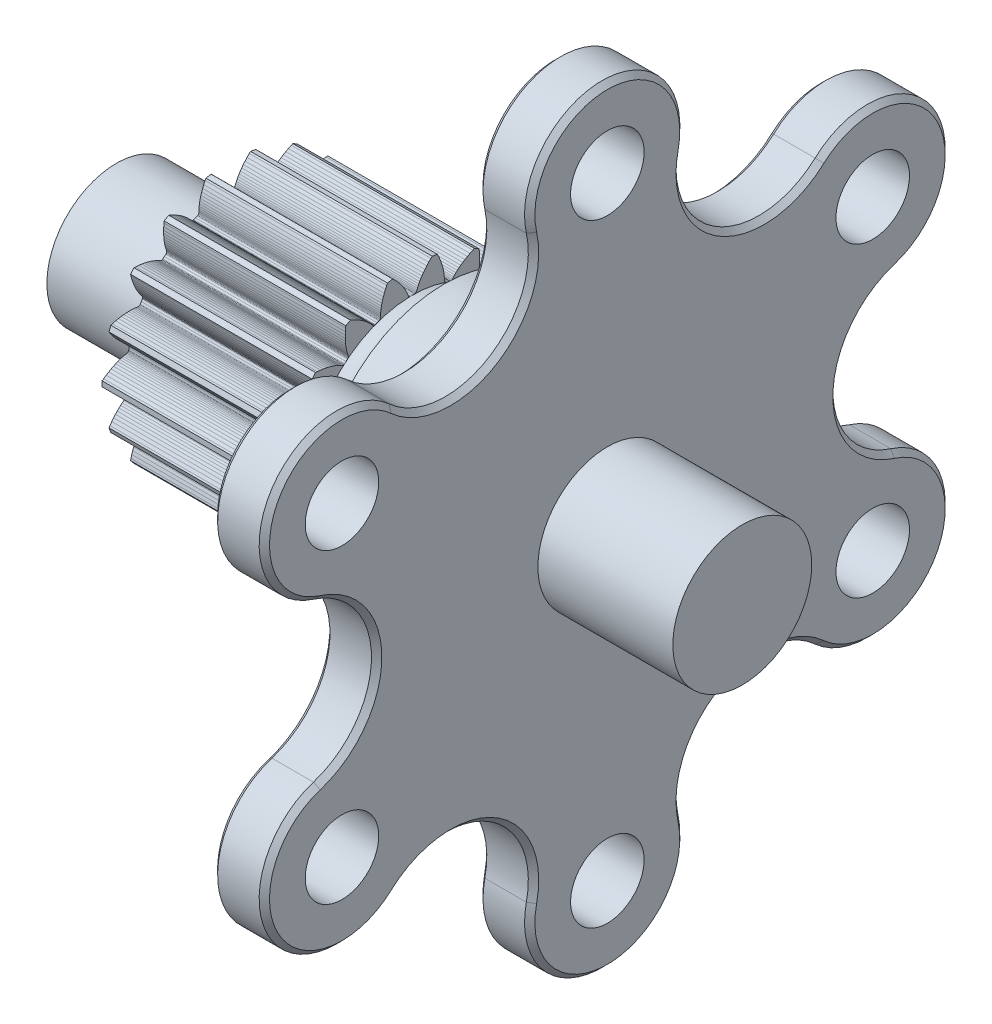
from build123d import *

# Parameters (mm, degrees)
SKETCH1_R              = 47
BASE_EXTRUDE_DEPTH     = 6.35
M8_CLEARANCE_HOLES_D   = 9
CIRPATTERN_COUNT       = 6
CUT_EXTRUDE_DEPTH      = 67.770670957
CUT_EXTRUDE_DEPTH_BACK = 67.770670957
CHAMFER1_SIZE          = 0.635
SKETCH8_R              = 15.748
SHAFT_EXTRUDE_DEPTH    = 52.5820005
CHAMFER3_SIZE          = 0.635
SHAFT_CHAMFER_SIZE     = 1
CUT_EXTRUDE1_START     = -12.856999432
SKETCH45_R             = 15.748
SKETCH45_R_2           = 8.5127
CUT_EXTRUDE1_DEPTH     = 12.856999432
SKETCH55_R             = 8.5
BOSS_EXTRUDE4_DEPTH    = 16.51
SKETCH56_R             = 8.5127
BOSS_EXTRUDE5_DEPTH    = 1.143
FILLET9_R              = 1.524
CUT_EXTRUDE16_START    = -22.225
CUT_EXTRUDE16_DEPTH    = 22.225


with BuildPart() as part:
    # Sketch1 → Base-Extrude (new body)
    with BuildSketch(Plane(origin=(0, 0, 0), x_dir=(0, 0, -1), z_dir=(1, 0, 0))):
        Circle(SKETCH1_R)
    extrude(amount=-BASE_EXTRUDE_DEPTH)

    # M8 Clearance Holes (through all)
    with Locations(Plane(origin=(0, 0, 0), x_dir=(0, 0, -1), z_dir=(1, 0, 0))):
        with Locations((0, -37.5)):
            m8_clearance_holes = Hole(M8_CLEARANCE_HOLES_D / 2)

    # CirPattern: M8 Clearance Holes ×6 about axis
    cirpattern_axis = Axis((-6.35, 0, 0), (1, 0, 0))
    for i in range(1, CIRPATTERN_COUNT):
        add(m8_clearance_holes.rotate(cirpattern_axis, i * 360 / CIRPATTERN_COUNT), mode=Mode.SUBTRACT)

    # Sketch19 → Cut-Extrude (cut, two sides: drawn at the far end of the back side and taken through both)
    with BuildSketch(Plane(origin=(0, 0, 0), x_dir=(0, 0, -1), z_dir=(1, 0, 0)).offset(-CUT_EXTRUDE_DEPTH_BACK)):
        with BuildLine():
            ThreePointArc((9.274838239, 35.443941724), (14.114033661, 24.446223401), (26.057934823, 25.754216393))
            ThreePointArc((26.057934823, 25.754216393), (33.921184851, 28.139425108), (40.703194264, 23.499999504))
            ThreePointArc((40.703194264, 23.499999504), (23.500000227, 40.703193847), (-4.7e-08, 47))
            ThreePointArc((-4.7e-08, 47), (7.40886473, 43.446320157), (9.274838239, 35.443941724))
        make_face()
        with BuildLine():
            ThreePointArc((-26.057934823, 25.754216393), (-14.114033661, 24.446223401), (-9.274838239, 35.443941724))
            ThreePointArc((-9.274838239, 35.443941724), (-7.40886476, 43.44632012), (-4.7e-08, 47))
            ThreePointArc((-4.7e-08, 47), (-23.500000787, 40.703193523), (-40.703194863, 23.499998466))
            ThreePointArc((-40.703194863, 23.499998466), (-33.921185443, 28.139425017), (-26.057934823, 25.754216393))
        make_face()
        with BuildLine():
            ThreePointArc((40.703193464, -23.50000089), (47, -8e-07), (40.703194264, 23.499999504))
            ThreePointArc((40.703194264, 23.499999504), (41.33004921, 15.30689472), (35.332773062, 9.689725331))
            ThreePointArc((35.332773062, 9.689725331), (28.228067323, 0), (35.332773062, -9.689725331))
            ThreePointArc((35.332773062, -9.689725331), (41.330049499, -15.306895465), (40.703193464, -23.50000089))
        make_face()
        with BuildLine():
            ThreePointArc((-35.332773062, 9.689725331), (-41.330048992, 15.306894161), (-40.703194863, 23.499998466))
            ThreePointArc((-40.703194863, 23.499998466), (-47, -6.9e-08), (-40.703194794, -23.499998586))
            ThreePointArc((-40.703194794, -23.499998586), (-41.330049018, -15.306894226), (-35.332773062, -9.689725331))
            ThreePointArc((-35.332773062, -9.689725331), (-28.228067323, 0), (-35.332773062, 9.689725331))
        make_face()
        with BuildLine():
            ThreePointArc((-26.057934823, -25.754216393), (-33.921185375, -28.139425028), (-40.703194794, -23.499998586))
            ThreePointArc((-40.703194794, -23.499998586), (-23.500000688, -40.703193581), (4.4e-08, -47))
            ThreePointArc((4.4e-08, -47), (-7.408864732, -43.446320155), (-9.274838239, -35.443941724))
            ThreePointArc((-9.274838239, -35.443941724), (-14.114033661, -24.446223401), (-26.057934823, -25.754216393))
        make_face()
        with BuildLine():
            ThreePointArc((4.4e-08, -47), (23.499999574, -40.703194224), (40.703193464, -23.50000089))
            ThreePointArc((40.703193464, -23.50000089), (33.92118406, -28.13942523), (26.057934823, -25.754216393))
            ThreePointArc((26.057934823, -25.754216393), (14.114033661, -24.446223401), (9.274838239, -35.443941724))
            ThreePointArc((9.274838239, -35.443941724), (7.408864759, -43.446320121), (4.4e-08, -47))
        make_face()
    extrude(amount=CUT_EXTRUDE_DEPTH + CUT_EXTRUDE_DEPTH_BACK, mode=Mode.SUBTRACT)

    # Chamfer1
    chamfer1_edges = [part.edges().sort_by_distance(p)[0] for p in [
        (-6.35, 0, 28.228067323),
        (-6.35, -23.5, 40.703193978),
        (-6.35, 23.5, 40.703193978),
        (-6.35, -24.446223401, 14.114033661),
        (-6.35, 24.446223401, 14.114033661),
        (-6.35, -47, 0),
        (-6.35, 47, 0),
        (-6.35, -24.446223401, -14.114033661),
        (-6.35, -23.5, -40.703193978),
        (-6.35, 0, -28.228067323),
        (-6.35, 23.5, -40.703193978),
        (-6.35, 24.446223401, -14.114033661),
    ]]
    chamfer(chamfer1_edges, length=CHAMFER1_SIZE)

    # Sketch8 → Shaft-Extrude (add)
    with BuildSketch(Plane.ZY.offset(6.35)):
        Circle(SKETCH8_R)
    extrude(amount=SHAFT_EXTRUDE_DEPTH)

    # Chamfer3
    chamfer3_edges = [part.edges().sort_by_distance(p)[0] for p in [
        (0, -23.5, 40.703193978),
        (0, 0, 28.228067323),
        (0, -24.446223401, 14.114033661),
        (0, 23.5, 40.703193978),
        (0, -47, 0),
        (0, 24.446223401, 14.114033661),
        (0, -24.446223401, -14.114033661),
        (0, 47, 0),
        (0, 24.446223401, -14.114033661),
        (0, -23.5, -40.703193978),
        (0, 0, -28.228067323),
        (0, 23.5, -40.703193978),
    ]]
    chamfer(chamfer3_edges, length=CHAMFER3_SIZE)

    # Shaft Chamfer
    shaft_chamfer_edges = [part.edges().sort_by_distance(p)[0] for p in [
        (-58.9320005, 0, -15.748),
    ]]
    chamfer(shaft_chamfer_edges, length=SHAFT_CHAMFER_SIZE)

    # Sketch45 → Cut-Extrude1 (cut)
    with BuildSketch(Plane.ZY.offset(58.9320005).offset(CUT_EXTRUDE1_START)):
        Circle(SKETCH45_R)
        Circle(SKETCH45_R_2, mode=Mode.SUBTRACT)
    extrude(amount=CUT_EXTRUDE1_DEPTH, mode=Mode.SUBTRACT)

    # Sketch55 → Boss-Extrude4 (add)
    with BuildSketch(Plane(origin=(0, 0, 0), x_dir=(0, 0, -1), z_dir=(1, 0, 0))):
        Circle(SKETCH55_R)
    extrude(amount=BOSS_EXTRUDE4_DEPTH)

    # Sketch56 → Boss-Extrude5 (add)
    with BuildSketch(Plane.ZY.offset(58.9320005)):
        Circle(SKETCH56_R)
    extrude(amount=BOSS_EXTRUDE5_DEPTH)

    # Fillet9
    fillet9_edges = [part.edges().sort_by_distance(p)[0] for p in [
        (-46.075001068, 0, -8.5127),
    ]]
    fillet(fillet9_edges, radius=FILLET9_R)

    # Sketch89 → Cut-Extrude16 (cut)
    with BuildSketch(Plane.ZY.offset(46.075001068).offset(CUT_EXTRUDE16_START)):
        with BuildLine():
            Line((14.905662373, 5.081410553), (14.7872836, 4.8999562))
            Line((14.7872836, 4.8999562), (14.5639901, 4.5862254))
            Line((14.5639901, 4.5862254), (14.3413189, 4.2995436))
            Line((14.3413189, 4.2995436), (14.1194165, 4.0372965))
            Line((14.1194165, 4.0372965), (13.9032487, 3.8025328))
            Line((13.9032487, 3.8025328), (13.6912318, 3.5907592))
            Line((13.6912318, 3.5907592), (13.4871377, 3.4033311))
            Line((13.4871377, 3.4033311), (13.2928477, 3.2393112))
            Line((13.2928477, 3.2393112), (13.106944, 3.0952812))
            Line((13.106944, 3.0952812), (12.9348864, 2.9731584))
            Line((12.9348864, 2.9731584), (12.774825, 2.8693266))
            Line((12.774825, 2.8693266), (12.6451501, 2.7921869))
            Line((12.6451501, 2.7921869), (12.5432319, 2.7213528))
            Line((12.5432319, 2.7213528), (12.5028003, 2.684827))
            Line((12.5028003, 2.684827), (12.469389, 2.6479348))
            Line((12.469389, 2.6479348), (12.4430003, 2.6109505))
            Line((12.4430003, 2.6109505), (12.4236152, 2.5741554))
            Line((12.4236152, 2.5741554), (12.4112164, 2.5378203))
            Line((12.4112164, 2.5378203), (12.4057633, 2.5022327))
            Line((12.4057633, 2.5022327), (12.4072206, 2.4676504))
            Line((12.4072206, 2.4676504), (12.4155284, 2.4245076))
            Line((12.4155284, 2.4245076), (12.4578181, 2.1966494))
            Line((12.4578181, 2.1966494), (12.4960109, 1.9680689))
            Line((12.4960109, 1.9680689), (12.5029598, 1.9246865))
            Line((12.5029598, 1.9246865), (12.5134182, 1.8916913))
            Line((12.5134182, 1.8916913), (12.5307141, 1.860115))
            Line((12.5307141, 1.860115), (12.5547926, 1.8302119))
            Line((12.5547926, 1.8302119), (12.5855933, 1.8022658))
            Line((12.5855933, 1.8022658), (12.6230398, 1.7765375))
            Line((12.6230398, 1.7765375), (12.6670541, 1.7532974))
            Line((12.6670541, 1.7532974), (12.71754, 1.7328028))
            Line((12.71754, 1.7328028), (12.8375384, 1.7010987))
            Line((12.8375384, 1.7010987), (12.9857762, 1.6729624))
            Line((12.9857762, 1.6729624), (13.1716974, 1.6301367))
            Line((13.1716974, 1.6301367), (13.3751471, 1.5742259))
            Line((13.3751471, 1.5742259), (13.5991006, 1.5024649))
            Line((13.5991006, 1.5024649), (13.8377716, 1.4147876))
            Line((13.8377716, 1.4147876), (14.0936614, 1.3084672))
            Line((14.0936614, 1.3084672), (14.365323, 1.1819791))
            Line((14.365323, 1.1819791), (14.6487482, 1.0353071))
            Line((14.6487482, 1.0353071), (14.9469621, 0.8647705))
            Line((14.9469621, 0.8647705), (15.2542554, 0.6715358))
            Line((15.2542554, 0.6715358), (15.571385, 0.4530962))
            Line((15.571385, 0.4530962), (15.744685707, 0.323072753))
            ThreePointArc((15.744685707, 0.323072753), (15.508752497, 2.734611488), (14.905662373, 5.081410553))
        make_face()
        with BuildLine():
            Line((14.4773476, 5.7514985), (14.68466758, 5.688588758))
            ThreePointArc((14.68466758, 5.688588758), (13.638168057, 7.874000004), (12.268796161, 9.873000798))
            Line((12.268796161, 9.873000798), (12.2196176, 9.6620015))
            Line((12.2196176, 9.6620015), (12.1170925, 9.2908201))
            Line((12.1170925, 9.2908201), (12.0059011, 8.9452694))
            Line((12.0059011, 8.9452694), (11.8870747, 8.6229426))
            Line((11.8870747, 8.6229426), (11.7642374, 8.3284031))
            Line((11.7642374, 8.3284031), (11.6374375, 8.0568869))
            Line((11.6374375, 8.0568869), (11.509756, 7.8109579))
            Line((11.509756, 7.8109579), (11.3832812, 7.5903785))
            Line((11.3832812, 7.5903785), (11.25785, 7.3914518))
            Line((11.25785, 7.3914518), (11.1379373, 7.2178467))
            Line((11.1379373, 7.2178467), (11.0230413, 7.0655325))
            Line((11.0230413, 7.0655325), (10.9275701, 6.9486934))
            Line((10.9275701, 6.9486934), (10.856025, 6.8472732))
            Line((10.856025, 6.8472732), (10.8305243, 6.7991217))
            Line((10.8305243, 6.7991217), (10.8117458, 6.753027))
            Line((10.8117458, 6.753027), (10.7995979, 6.7092477))
            Line((10.7995979, 6.7092477), (10.7939666, 6.6680415))
            Line((10.7939666, 6.6680415), (10.7947428, 6.629657))
            Line((10.7947428, 6.629657), (10.8017902, 6.5943506))
            Line((10.8017902, 6.5943506), (10.8149875, 6.5623522))
            Line((10.8149875, 6.5623522), (10.83755, 6.5246527))
            Line((10.83755, 6.5246527), (10.9552214, 6.325))
            Line((10.9552214, 6.325), (11.06929, 6.1232673))
            Line((11.06929, 6.1232673), (11.0906575, 6.0848778))
            Line((11.0906575, 6.0848778), (11.1117702, 6.0574494))
            Line((11.1117702, 6.0574494), (11.1388228, 6.033693))
            Line((11.1388228, 6.033693), (11.1716766, 6.0138285))
            Line((11.1716766, 6.0138285), (11.2101779, 5.9981023))
            Line((11.2101779, 5.9981023), (11.2541658, 5.986733))
            Line((11.2541658, 5.986733), (11.3034743, 5.9799483))
            Line((11.3034743, 5.9799483), (11.357925, 5.9779568))
            Line((11.357925, 5.9779568), (11.4815301, 5.9892066))
            Line((11.4815301, 5.9892066), (11.6304513, 6.0134675))
            Line((11.6304513, 6.0134675), (11.8198073, 6.0368133))
            Line((11.8198073, 6.0368133), (12.03011, 6.0538582))
            Line((12.03011, 6.0538582), (12.2651012, 6.0630215))
            Line((12.2651012, 6.0630215), (12.519366, 6.0622621))
            Line((12.519366, 6.0622621), (12.7961875, 6.0498731))
            Line((12.7961875, 6.0498731), (13.0947274, 6.0239269))
            Line((13.0947274, 6.0239269), (13.4112247, 5.9830374))
            Line((13.4112247, 5.9830374), (13.7497811, 5.9247806))
            Line((13.7497811, 5.9247806), (14.1046325, 5.8482999))
            Line((14.1046325, 5.8482999), (14.4773476, 5.7514985))
        make_face()
        with BuildLine():
            ThreePointArc((14.905662372, -5.081410558), (15.508752496, -2.734611494), (15.744685706, -0.323072759))
            Line((15.744685706, -0.323072759), (15.571385, -0.4530962))
            Line((15.571385, -0.4530962), (15.2542554, -0.6715358))
            Line((15.2542554, -0.6715358), (14.9469621, -0.8647705))
            Line((14.9469621, -0.8647705), (14.6487482, -1.0353071))
            Line((14.6487482, -1.0353071), (14.365323, -1.1819791))
            Line((14.365323, -1.1819791), (14.0936614, -1.3084672))
            Line((14.0936614, -1.3084672), (13.8377716, -1.4147876))
            Line((13.8377716, -1.4147876), (13.5991006, -1.5024649))
            Line((13.5991006, -1.5024649), (13.3751471, -1.5742259))
            Line((13.3751471, -1.5742259), (13.1716974, -1.6301367))
            Line((13.1716974, -1.6301367), (12.9857762, -1.6729624))
            Line((12.9857762, -1.6729624), (12.8375384, -1.7010987))
            Line((12.8375384, -1.7010987), (12.71754, -1.7328028))
            Line((12.71754, -1.7328028), (12.6670541, -1.7532974))
            Line((12.6670541, -1.7532974), (12.6230398, -1.7765375))
            Line((12.6230398, -1.7765375), (12.5855933, -1.8022658))
            Line((12.5855933, -1.8022658), (12.5547926, -1.8302119))
            Line((12.5547926, -1.8302119), (12.5307141, -1.860115))
            Line((12.5307141, -1.860115), (12.5134182, -1.8916913))
            Line((12.5134182, -1.8916913), (12.5029598, -1.9246865))
            Line((12.5029598, -1.9246865), (12.4960109, -1.9680689))
            Line((12.4960109, -1.9680689), (12.4578181, -2.1966494))
            Line((12.4578181, -2.1966494), (12.4155284, -2.4245076))
            Line((12.4155284, -2.4245076), (12.4072206, -2.4676504))
            Line((12.4072206, -2.4676504), (12.4057633, -2.5022327))
            Line((12.4057633, -2.5022327), (12.4112164, -2.5378203))
            Line((12.4112164, -2.5378203), (12.4236152, -2.5741554))
            Line((12.4236152, -2.5741554), (12.4430003, -2.6109505))
            Line((12.4430003, -2.6109505), (12.469389, -2.6479348))
            Line((12.469389, -2.6479348), (12.5028003, -2.684827))
            Line((12.5028003, -2.684827), (12.5432319, -2.7213528))
            Line((12.5432319, -2.7213528), (12.6451501, -2.7921869))
            Line((12.6451501, -2.7921869), (12.774825, -2.8693266))
            Line((12.774825, -2.8693266), (12.9348864, -2.9731584))
            Line((12.9348864, -2.9731584), (13.106944, -3.0952812))
            Line((13.106944, -3.0952812), (13.2928477, -3.2393112))
            Line((13.2928477, -3.2393112), (13.4871377, -3.4033311))
            Line((13.4871377, -3.4033311), (13.6912318, -3.5907592))
            Line((13.6912318, -3.5907592), (13.9032487, -3.8025328))
            Line((13.9032487, -3.8025328), (14.1194165, -4.0372965))
            Line((14.1194165, -4.0372965), (14.3413189, -4.2995436))
            Line((14.3413189, -4.2995436), (14.5639901, -4.5862254))
            Line((14.5639901, -4.5862254), (14.7872836, -4.8999562))
            Line((14.7872836, -4.8999562), (14.905662372, -5.081410558))
        make_face()
        with BuildLine():
            Line((11.6371283, 10.3561852), (11.853461816, 10.367976995))
            ThreePointArc((11.853461816, 10.367976995), (10.122619272, 12.063667894), (8.152132074, 13.473761414))
            Line((8.152132074, 13.473761414), (8.1780853, 13.2586669))
            Line((8.1780853, 13.2586669), (8.2086948, 12.8748048))
            Line((8.2086948, 12.8748048), (8.2223943, 12.5120636))
            Line((8.2223943, 12.5120636), (8.2209763, 12.1685346))
            Line((8.2209763, 12.1685346), (8.2062854, 11.8497451))
            Line((8.2062854, 11.8497451), (8.1799965, 11.5512353))
            Line((8.1799965, 11.5512353), (8.1441278, 11.2764679))
            Line((8.1441278, 11.2764679), (8.100723, 11.0259342))
            Line((8.100723, 11.0259342), (8.0508932, 10.7961042))
            Line((8.0508932, 10.7961042), (7.9975885, 10.5919562))
            Line((7.9975885, 10.5919562), (7.9417161, 10.4095309))
            Line((7.9417161, 10.4095309), (7.8919638, 10.267085))
            Line((7.8919638, 10.267085), (7.8594212, 10.1473113))
            Line((7.8594212, 10.1473113), (7.8519271, 10.093342))
            Line((7.8519271, 10.093342), (7.8500465, 10.0436044))
            Line((7.8500465, 10.0436044), (7.8536046, 9.9983106))
            Line((7.8536046, 9.9983106), (7.8624063, 9.9576633))
            Line((7.8624063, 9.9576633), (7.8762639, 9.9218593))
            Line((7.8762639, 9.9218593), (7.8949618, 9.8910924))
            Line((7.8949618, 9.8910924), (7.9183073, 9.8655375))
            Line((7.9183073, 9.8655375), (7.9524031, 9.8378284))
            Line((7.9524031, 9.8378284), (8.1312633, 9.6904622))
            Line((8.1312633, 9.6904622), (8.3074494, 9.5399092))
            Line((8.3074494, 9.5399092), (8.3406582, 9.511143))
            Line((8.3406582, 9.511143), (8.3698787, 9.4925898))
            Line((8.3698787, 9.4925898), (8.403425, 9.4795185))
            Line((8.403425, 9.4795185), (8.4410916, 9.4720887))
            Line((8.4410916, 9.4720887), (8.4826497, 9.4704791))
            Line((8.4826497, 9.4704791), (8.5278733, 9.4748403))
            Line((8.5278733, 9.4748403), (8.5765286, 9.4853292))
            Line((8.5765286, 9.4853292), (8.6283766, 9.5020811))
            Line((8.6283766, 9.5020811), (8.7406798, 9.5549278))
            Line((8.7406798, 9.5549278), (8.8723222, 9.6286596))
            Line((8.8723222, 9.6286596), (9.0422739, 9.7153611))
            Line((9.0422739, 9.7153611), (9.2340642, 9.8033059))
            Line((9.2340642, 9.8033059), (9.4517497, 9.8922882))
            Line((9.4517497, 9.8922882), (9.6909401, 9.9785383))
            Line((9.6909401, 9.9785383), (9.9553045, 10.061575))
            Line((9.9553045, 10.061575), (10.2447144, 10.1393002))
            Line((10.2447144, 10.1393002), (10.5561096, 10.2091251))
            Line((10.5561096, 10.2091251), (10.8941735, 10.2701747))
            Line((10.8941735, 10.2701747), (11.2537827, 10.3196727))
            Line((11.2537827, 10.3196727), (11.6371283, 10.3561852))
        make_face()
        with BuildLine():
            ThreePointArc((12.268796171, -9.873000785), (13.63816806, -7.873999998), (14.684667579, -5.688588761))
            Line((14.684667579, -5.688588761), (14.4773476, -5.7514985))
            Line((14.4773476, -5.7514985), (14.1046325, -5.8482999))
            Line((14.1046325, -5.8482999), (13.7497811, -5.9247806))
            Line((13.7497811, -5.9247806), (13.4112247, -5.9830374))
            Line((13.4112247, -5.9830374), (13.0947274, -6.0239269))
            Line((13.0947274, -6.0239269), (12.7961875, -6.0498731))
            Line((12.7961875, -6.0498731), (12.519366, -6.0622621))
            Line((12.519366, -6.0622621), (12.2651012, -6.0630215))
            Line((12.2651012, -6.0630215), (12.03011, -6.0538582))
            Line((12.03011, -6.0538582), (11.8198073, -6.0368133))
            Line((11.8198073, -6.0368133), (11.6304513, -6.0134675))
            Line((11.6304513, -6.0134675), (11.4815301, -5.9892066))
            Line((11.4815301, -5.9892066), (11.357925, -5.9779568))
            Line((11.357925, -5.9779568), (11.3034743, -5.9799483))
            Line((11.3034743, -5.9799483), (11.2541658, -5.986733))
            Line((11.2541658, -5.986733), (11.2101779, -5.9981023))
            Line((11.2101779, -5.9981023), (11.1716766, -6.0138285))
            Line((11.1716766, -6.0138285), (11.1388228, -6.033693))
            Line((11.1388228, -6.033693), (11.1117702, -6.0574494))
            Line((11.1117702, -6.0574494), (11.0906575, -6.0848778))
            Line((11.0906575, -6.0848778), (11.06929, -6.1232673))
            Line((11.06929, -6.1232673), (10.9552214, -6.325))
            Line((10.9552214, -6.325), (10.83755, -6.5246527))
            Line((10.83755, -6.5246527), (10.8149875, -6.5623522))
            Line((10.8149875, -6.5623522), (10.8017902, -6.5943506))
            Line((10.8017902, -6.5943506), (10.7947428, -6.629657))
            Line((10.7947428, -6.629657), (10.7939666, -6.6680415))
            Line((10.7939666, -6.6680415), (10.7995979, -6.7092477))
            Line((10.7995979, -6.7092477), (10.8117458, -6.753027))
            Line((10.8117458, -6.753027), (10.8305243, -6.7991217))
            Line((10.8305243, -6.7991217), (10.856025, -6.8472732))
            Line((10.856025, -6.8472732), (10.9275701, -6.9486934))
            Line((10.9275701, -6.9486934), (11.0230413, -7.0655325))
            Line((11.0230413, -7.0655325), (11.1379373, -7.2178467))
            Line((11.1379373, -7.2178467), (11.25785, -7.3914518))
            Line((11.25785, -7.3914518), (11.3832812, -7.5903785))
            Line((11.3832812, -7.5903785), (11.509756, -7.8109579))
            Line((11.509756, -7.8109579), (11.6374375, -8.0568869))
            Line((11.6374375, -8.0568869), (11.7642374, -8.3284031))
            Line((11.7642374, -8.3284031), (11.8870747, -8.6229426))
            Line((11.8870747, -8.6229426), (12.0059011, -8.9452694))
            Line((12.0059011, -8.9452694), (12.1170925, -9.2908201))
            Line((12.1170925, -9.2908201), (12.2196176, -9.6620015))
            Line((12.2196176, -9.6620015), (12.268796171, -9.873000785))
        make_face()
        with BuildLine():
            Line((7.3932997, 13.7117631), (7.592553638, 13.796834175))
            ThreePointArc((7.592553638, 13.796834175), (5.386133218, 14.798279392), (3.052200538, 15.449387557))
            Line((3.052200538, 15.449387557), (3.1501553, 15.2561413))
            Line((3.1501553, 15.2561413), (3.3102073, 14.9058981))
            Line((3.3102073, 14.9058981), (3.4471455, 14.5697183))
            Line((3.4471455, 14.5697183), (3.5633069, 14.2464216))
            Line((3.5633069, 14.2464216), (3.6585343, 13.941833))
            Line((3.6585343, 13.941833), (3.7359273, 13.6523341))
            Line((3.7359273, 13.6523341), (3.7961976, 13.3818694))
            Line((3.7961976, 13.3818694), (3.8410981, 13.1315994))
            Line((3.8410981, 13.1315994), (3.8728798, 12.8985871))
            Line((3.8728798, 12.8985871), (3.8926125, 12.6885195))
            Line((3.8926125, 12.6885195), (3.9025028, 12.4979862))
            Line((3.9025028, 12.4979862), (3.9044703, 12.3471146))
            Line((3.9044703, 12.3471146), (3.9148553, 12.2234339))
            Line((3.9148553, 12.2234339), (3.9262717, 12.1701562))
            Line((3.9262717, 12.1701562), (3.9415157, 12.122775))
            Line((3.9415157, 12.122775), (3.9603507, 12.0814297))
            Line((3.9603507, 12.0814297), (3.9825237, 12.0462441))
            Line((3.9825237, 12.0462441), (4.0077913, 12.0173388))
            Line((4.0077913, 12.0173388), (4.0358845, 11.9948225))
            Line((4.0358845, 11.9948225), (4.0665624, 11.9787934))
            Line((4.0665624, 11.9787934), (4.108079, 11.9644168))
            Line((4.108079, 11.9644168), (4.3265548, 11.8871117))
            Line((4.3265548, 11.8871117), (4.5436078, 11.8058973))
            Line((4.5436078, 11.8058973), (4.5846525, 11.790224))
            Line((4.5846525, 11.790224), (4.6184564, 11.7827837))
            Line((4.6184564, 11.7827837), (4.6544502, 11.7819743))
            Line((4.6544502, 11.7819743), (4.6923863, 11.7878752))
            Line((4.6923863, 11.7878752), (4.7319887, 11.8005764))
            Line((4.7319887, 11.8005764), (4.7729934, 11.8201419))
            Line((4.7729934, 11.8201419), (4.815127, 11.8466394))
            Line((4.815127, 11.8466394), (4.8581187, 11.8801141))
            Line((4.8581187, 11.8801141), (4.9455745, 11.9681837))
            Line((4.9455745, 11.9681837), (5.0440601, 12.0824933))
            Line((5.0440601, 12.0824933), (5.1741089, 12.2220929))
            Line((5.1741089, 12.2220929), (5.3242539, 12.3703301))
            Line((5.3242539, 12.3703301), (5.4983776, 12.528399))
            Line((5.4983776, 12.528399), (5.6936438, 12.6912555))
            Line((5.6936438, 12.6912555), (5.9136649, 12.8597024))
            Line((5.9136649, 12.8597024), (6.1590376, 13.0317242))
            Line((6.1590376, 13.0317242), (6.4277719, 13.2038416))
            Line((6.4277719, 13.2038416), (6.7245678, 13.3768342))
            Line((6.7245678, 13.3768342), (7.0455607, 13.5463406))
            Line((7.0455607, 13.5463406), (7.3932997, 13.7117631))
        make_face()
        with BuildLine():
            ThreePointArc((8.152132052, -13.473761428), (10.122619257, -12.063667907), (11.853461807, -10.367977006))
            Line((11.853461807, -10.367977006), (11.6371283, -10.3561852))
            Line((11.6371283, -10.3561852), (11.2537827, -10.3196727))
            Line((11.2537827, -10.3196727), (10.8941735, -10.2701747))
            Line((10.8941735, -10.2701747), (10.5561096, -10.2091251))
            Line((10.5561096, -10.2091251), (10.2447144, -10.1393002))
            Line((10.2447144, -10.1393002), (9.9553045, -10.061575))
            Line((9.9553045, -10.061575), (9.6909401, -9.9785383))
            Line((9.6909401, -9.9785383), (9.4517497, -9.8922882))
            Line((9.4517497, -9.8922882), (9.2340642, -9.8033059))
            Line((9.2340642, -9.8033059), (9.0422739, -9.7153611))
            Line((9.0422739, -9.7153611), (8.8723222, -9.6286596))
            Line((8.8723222, -9.6286596), (8.7406798, -9.5549278))
            Line((8.7406798, -9.5549278), (8.6283766, -9.5020811))
            Line((8.6283766, -9.5020811), (8.5765286, -9.4853292))
            Line((8.5765286, -9.4853292), (8.5278733, -9.4748403))
            Line((8.5278733, -9.4748403), (8.4826497, -9.4704791))
            Line((8.4826497, -9.4704791), (8.4410916, -9.4720887))
            Line((8.4410916, -9.4720887), (8.403425, -9.4795185))
            Line((8.403425, -9.4795185), (8.3698787, -9.4925898))
            Line((8.3698787, -9.4925898), (8.3406582, -9.511143))
            Line((8.3406582, -9.511143), (8.3074494, -9.5399092))
            Line((8.3074494, -9.5399092), (8.1312633, -9.6904622))
            Line((8.1312633, -9.6904622), (7.9524031, -9.8378284))
            Line((7.9524031, -9.8378284), (7.9183073, -9.8655375))
            Line((7.9183073, -9.8655375), (7.8949618, -9.8910924))
            Line((7.8949618, -9.8910924), (7.8762639, -9.9218593))
            Line((7.8762639, -9.9218593), (7.8624063, -9.9576633))
            Line((7.8624063, -9.9576633), (7.8536046, -9.9983106))
            Line((7.8536046, -9.9983106), (7.8500465, -10.0436044))
            Line((7.8500465, -10.0436044), (7.8519271, -10.093342))
            Line((7.8519271, -10.093342), (7.8594212, -10.1473113))
            Line((7.8594212, -10.1473113), (7.8919638, -10.267085))
            Line((7.8919638, -10.267085), (7.9417161, -10.4095309))
            Line((7.9417161, -10.4095309), (7.9975885, -10.5919562))
            Line((7.9975885, -10.5919562), (8.0508932, -10.7961042))
            Line((8.0508932, -10.7961042), (8.100723, -11.0259342))
            Line((8.100723, -11.0259342), (8.1441278, -11.2764679))
            Line((8.1441278, -11.2764679), (8.1799965, -11.5512353))
            Line((8.1799965, -11.5512353), (8.2062854, -11.8497451))
            Line((8.2062854, -11.8497451), (8.2209763, -12.1685346))
            Line((8.2209763, -12.1685346), (8.2223943, -12.5120636))
            Line((8.2223943, -12.5120636), (8.2086948, -12.8748048))
            Line((8.2086948, -12.8748048), (8.1780853, -13.2586669))
            Line((8.1780853, -13.2586669), (8.152132052, -13.473761428))
        make_face()
        with BuildLine():
            Line((2.25773, 15.4135), (2.415871395, 15.561589553))
            ThreePointArc((2.415871395, 15.561589553), (-3.4e-08, 15.748), (-2.415871463, 15.561589542))
            Line((-2.415871463, 15.561589542), (-2.25773, 15.4135))
            Line((-2.25773, 15.4135), (-1.98754, 15.13912))
            Line((-1.98754, 15.13912), (-1.74388, 14.87005))
            Line((-1.74388, 14.87005), (-1.52415, 14.60598))
            Line((-1.52415, 14.60598), (-1.33049, 14.35233))
            Line((-1.33049, 14.35233), (-1.15875, 14.10676))
            Line((-1.15875, 14.10676), (-1.00961, 13.87322))
            Line((-1.00961, 13.87322), (-0.88182, 13.6534))
            Line((-0.88182, 13.6534), (-0.77226, 13.44531))
            Line((-0.77226, 13.44531), (-0.68187, 13.25466))
            Line((-0.68187, 13.25466), (-0.60741, 13.079))
            Line((-0.60741, 13.079), (-0.55396, 12.9379))
            Line((-0.55396, 12.9379), (-0.5019, 12.82523))
            Line((-0.5019, 12.82523), (-0.47295, 12.77907))
            Line((-0.47295, 12.77907), (-0.44242, 12.73976))
            Line((-0.44242, 12.73976), (-0.41058, 12.70735))
            Line((-0.41058, 12.70735), (-0.37771, 12.68187))
            Line((-0.37771, 12.68187), (-0.34408, 12.66335))
            Line((-0.34408, 12.66335), (-0.30998, 12.6518))
            Line((-0.30998, 12.6518), (-0.27567, 12.64723))
            Line((-0.27567, 12.64723), (-0.23174, 12.64792))
            Line((-0.23174, 12.64792), (0, 12.65))
            Line((0, 12.65), (0.23174, 12.64792))
            Line((0.23174, 12.64792), (0.27567, 12.64723))
            Line((0.27567, 12.64723), (0.30998, 12.6518))
            Line((0.30998, 12.6518), (0.34408, 12.66335))
            Line((0.34408, 12.66335), (0.37771, 12.68187))
            Line((0.37771, 12.68187), (0.41058, 12.70735))
            Line((0.41058, 12.70735), (0.44242, 12.73976))
            Line((0.44242, 12.73976), (0.47295, 12.77907))
            Line((0.47295, 12.77907), (0.5019, 12.82523))
            Line((0.5019, 12.82523), (0.55396, 12.9379))
            Line((0.55396, 12.9379), (0.60741, 13.079))
            Line((0.60741, 13.079), (0.68187, 13.25466))
            Line((0.68187, 13.25466), (0.77226, 13.44531))
            Line((0.77226, 13.44531), (0.88182, 13.6534))
            Line((0.88182, 13.6534), (1.00961, 13.87322))
            Line((1.00961, 13.87322), (1.15875, 14.10676))
            Line((1.15875, 14.10676), (1.33049, 14.35233))
            Line((1.33049, 14.35233), (1.52415, 14.60598))
            Line((1.52415, 14.60598), (1.74388, 14.87005))
            Line((1.74388, 14.87005), (1.98754, 15.13912))
            Line((1.98754, 15.13912), (2.25773, 15.4135))
        make_face()
        with BuildLine():
            ThreePointArc((3.05220052, -15.44938756), (5.386133201, -14.798279398), (7.592553624, -13.796834183))
            Line((7.592553624, -13.796834183), (7.3932997, -13.7117631))
            Line((7.3932997, -13.7117631), (7.0455607, -13.5463406))
            Line((7.0455607, -13.5463406), (6.7245678, -13.3768342))
            Line((6.7245678, -13.3768342), (6.4277719, -13.2038416))
            Line((6.4277719, -13.2038416), (6.1590376, -13.0317242))
            Line((6.1590376, -13.0317242), (5.9136649, -12.8597024))
            Line((5.9136649, -12.8597024), (5.6936438, -12.6912555))
            Line((5.6936438, -12.6912555), (5.4983776, -12.528399))
            Line((5.4983776, -12.528399), (5.3242539, -12.3703301))
            Line((5.3242539, -12.3703301), (5.1741089, -12.2220929))
            Line((5.1741089, -12.2220929), (5.0440601, -12.0824933))
            Line((5.0440601, -12.0824933), (4.9455745, -11.9681837))
            Line((4.9455745, -11.9681837), (4.8581187, -11.8801141))
            Line((4.8581187, -11.8801141), (4.815127, -11.8466394))
            Line((4.815127, -11.8466394), (4.7729934, -11.8201419))
            Line((4.7729934, -11.8201419), (4.7319887, -11.8005764))
            Line((4.7319887, -11.8005764), (4.6923863, -11.7878752))
            Line((4.6923863, -11.7878752), (4.6544502, -11.7819743))
            Line((4.6544502, -11.7819743), (4.6184564, -11.7827837))
            Line((4.6184564, -11.7827837), (4.5846525, -11.790224))
            Line((4.5846525, -11.790224), (4.5436078, -11.8058973))
            Line((4.5436078, -11.8058973), (4.3265548, -11.8871117))
            Line((4.3265548, -11.8871117), (4.108079, -11.9644168))
            Line((4.108079, -11.9644168), (4.0665624, -11.9787934))
            Line((4.0665624, -11.9787934), (4.0358845, -11.9948225))
            Line((4.0358845, -11.9948225), (4.0077913, -12.0173388))
            Line((4.0077913, -12.0173388), (3.9825237, -12.0462441))
            Line((3.9825237, -12.0462441), (3.9603507, -12.0814297))
            Line((3.9603507, -12.0814297), (3.9415157, -12.122775))
            Line((3.9415157, -12.122775), (3.9262717, -12.1701562))
            Line((3.9262717, -12.1701562), (3.9148553, -12.2234339))
            Line((3.9148553, -12.2234339), (3.9044703, -12.3471146))
            Line((3.9044703, -12.3471146), (3.9025028, -12.4979862))
            Line((3.9025028, -12.4979862), (3.8926125, -12.6885195))
            Line((3.8926125, -12.6885195), (3.8728798, -12.8985871))
            Line((3.8728798, -12.8985871), (3.8410981, -13.1315994))
            Line((3.8410981, -13.1315994), (3.7961976, -13.3818694))
            Line((3.7961976, -13.3818694), (3.7359273, -13.6523341))
            Line((3.7359273, -13.6523341), (3.6585343, -13.941833))
            Line((3.6585343, -13.941833), (3.5633069, -14.2464216))
            Line((3.5633069, -14.2464216), (3.4471455, -14.5697183))
            Line((3.4471455, -14.5697183), (3.3102073, -14.9058981))
            Line((3.3102073, -14.9058981), (3.1501553, -15.2561413))
            Line((3.1501553, -15.2561413), (3.05220052, -15.44938756))
        make_face()
        with BuildLine():
            Line((-3.1501553, 15.2561413), (-3.05220052, 15.44938756))
            ThreePointArc((-3.05220052, 15.44938756), (-5.386133201, 14.798279398), (-7.592553624, 13.796834183))
            Line((-7.592553624, 13.796834183), (-7.3932997, 13.7117631))
            Line((-7.3932997, 13.7117631), (-7.0455607, 13.5463406))
            Line((-7.0455607, 13.5463406), (-6.7245678, 13.3768342))
            Line((-6.7245678, 13.3768342), (-6.4277719, 13.2038416))
            Line((-6.4277719, 13.2038416), (-6.1590376, 13.0317242))
            Line((-6.1590376, 13.0317242), (-5.9136649, 12.8597024))
            Line((-5.9136649, 12.8597024), (-5.6936438, 12.6912555))
            Line((-5.6936438, 12.6912555), (-5.4983776, 12.528399))
            Line((-5.4983776, 12.528399), (-5.3242539, 12.3703301))
            Line((-5.3242539, 12.3703301), (-5.1741089, 12.2220929))
            Line((-5.1741089, 12.2220929), (-5.0440601, 12.0824933))
            Line((-5.0440601, 12.0824933), (-4.9455745, 11.9681837))
            Line((-4.9455745, 11.9681837), (-4.8581187, 11.8801141))
            Line((-4.8581187, 11.8801141), (-4.815127, 11.8466394))
            Line((-4.815127, 11.8466394), (-4.7729934, 11.8201419))
            Line((-4.7729934, 11.8201419), (-4.7319887, 11.8005764))
            Line((-4.7319887, 11.8005764), (-4.6923863, 11.7878752))
            Line((-4.6923863, 11.7878752), (-4.6544502, 11.7819743))
            Line((-4.6544502, 11.7819743), (-4.6184564, 11.7827837))
            Line((-4.6184564, 11.7827837), (-4.5846525, 11.790224))
            Line((-4.5846525, 11.790224), (-4.5436078, 11.8058973))
            Line((-4.5436078, 11.8058973), (-4.3265548, 11.8871117))
            Line((-4.3265548, 11.8871117), (-4.108079, 11.9644168))
            Line((-4.108079, 11.9644168), (-4.0665624, 11.9787934))
            Line((-4.0665624, 11.9787934), (-4.0358845, 11.9948225))
            Line((-4.0358845, 11.9948225), (-4.0077913, 12.0173388))
            Line((-4.0077913, 12.0173388), (-3.9825237, 12.0462441))
            Line((-3.9825237, 12.0462441), (-3.9603507, 12.0814297))
            Line((-3.9603507, 12.0814297), (-3.9415157, 12.122775))
            Line((-3.9415157, 12.122775), (-3.9262717, 12.1701562))
            Line((-3.9262717, 12.1701562), (-3.9148553, 12.2234339))
            Line((-3.9148553, 12.2234339), (-3.9044703, 12.3471146))
            Line((-3.9044703, 12.3471146), (-3.9025028, 12.4979862))
            Line((-3.9025028, 12.4979862), (-3.8926125, 12.6885195))
            Line((-3.8926125, 12.6885195), (-3.8728798, 12.8985871))
            Line((-3.8728798, 12.8985871), (-3.8410981, 13.1315994))
            Line((-3.8410981, 13.1315994), (-3.7961976, 13.3818694))
            Line((-3.7961976, 13.3818694), (-3.7359273, 13.6523341))
            Line((-3.7359273, 13.6523341), (-3.6585343, 13.941833))
            Line((-3.6585343, 13.941833), (-3.5633069, 14.2464216))
            Line((-3.5633069, 14.2464216), (-3.4471455, 14.5697183))
            Line((-3.4471455, 14.5697183), (-3.3102073, 14.9058981))
            Line((-3.3102073, 14.9058981), (-3.1501553, 15.2561413))
        make_face()
        with BuildLine():
            ThreePointArc((-2.415871395, -15.561589553), (3.4e-08, -15.748), (2.415871463, -15.561589542))
            Line((2.415871463, -15.561589542), (2.25773, -15.4135))
            Line((2.25773, -15.4135), (1.98754, -15.13912))
            Line((1.98754, -15.13912), (1.74388, -14.87005))
            Line((1.74388, -14.87005), (1.52415, -14.60598))
            Line((1.52415, -14.60598), (1.33049, -14.35233))
            Line((1.33049, -14.35233), (1.15875, -14.10676))
            Line((1.15875, -14.10676), (1.00961, -13.87322))
            Line((1.00961, -13.87322), (0.88182, -13.6534))
            Line((0.88182, -13.6534), (0.77226, -13.44531))
            Line((0.77226, -13.44531), (0.68187, -13.25466))
            Line((0.68187, -13.25466), (0.60741, -13.079))
            Line((0.60741, -13.079), (0.55396, -12.9379))
            Line((0.55396, -12.9379), (0.5019, -12.82523))
            Line((0.5019, -12.82523), (0.47295, -12.77907))
            Line((0.47295, -12.77907), (0.44242, -12.73976))
            Line((0.44242, -12.73976), (0.41058, -12.70735))
            Line((0.41058, -12.70735), (0.37771, -12.68187))
            Line((0.37771, -12.68187), (0.34408, -12.66335))
            Line((0.34408, -12.66335), (0.30998, -12.6518))
            Line((0.30998, -12.6518), (0.27567, -12.64723))
            Line((0.27567, -12.64723), (0.23174, -12.64792))
            Line((0.23174, -12.64792), (0, -12.65))
            Line((0, -12.65), (-0.23174, -12.64792))
            Line((-0.23174, -12.64792), (-0.27567, -12.64723))
            Line((-0.27567, -12.64723), (-0.30998, -12.6518))
            Line((-0.30998, -12.6518), (-0.34408, -12.66335))
            Line((-0.34408, -12.66335), (-0.37771, -12.68187))
            Line((-0.37771, -12.68187), (-0.41058, -12.70735))
            Line((-0.41058, -12.70735), (-0.44242, -12.73976))
            Line((-0.44242, -12.73976), (-0.47295, -12.77907))
            Line((-0.47295, -12.77907), (-0.5019, -12.82523))
            Line((-0.5019, -12.82523), (-0.55396, -12.9379))
            Line((-0.55396, -12.9379), (-0.60741, -13.079))
            Line((-0.60741, -13.079), (-0.68187, -13.25466))
            Line((-0.68187, -13.25466), (-0.77226, -13.44531))
            Line((-0.77226, -13.44531), (-0.88182, -13.6534))
            Line((-0.88182, -13.6534), (-1.00961, -13.87322))
            Line((-1.00961, -13.87322), (-1.15875, -14.10676))
            Line((-1.15875, -14.10676), (-1.33049, -14.35233))
            Line((-1.33049, -14.35233), (-1.52415, -14.60598))
            Line((-1.52415, -14.60598), (-1.74388, -14.87005))
            Line((-1.74388, -14.87005), (-1.98754, -15.13912))
            Line((-1.98754, -15.13912), (-2.25773, -15.4135))
            Line((-2.25773, -15.4135), (-2.415871395, -15.561589553))
        make_face()
        with BuildLine():
            Line((-8.1780853, 13.2586669), (-8.152132052, 13.473761428))
            ThreePointArc((-8.152132052, 13.473761428), (-10.122619257, 12.063667907), (-11.853461807, 10.367977006))
            Line((-11.853461807, 10.367977006), (-11.6371283, 10.3561852))
            Line((-11.6371283, 10.3561852), (-11.2537827, 10.3196727))
            Line((-11.2537827, 10.3196727), (-10.8941735, 10.2701747))
            Line((-10.8941735, 10.2701747), (-10.5561096, 10.2091251))
            Line((-10.5561096, 10.2091251), (-10.2447144, 10.1393002))
            Line((-10.2447144, 10.1393002), (-9.9553045, 10.061575))
            Line((-9.9553045, 10.061575), (-9.6909401, 9.9785383))
            Line((-9.6909401, 9.9785383), (-9.4517497, 9.8922882))
            Line((-9.4517497, 9.8922882), (-9.2340642, 9.8033059))
            Line((-9.2340642, 9.8033059), (-9.0422739, 9.7153611))
            Line((-9.0422739, 9.7153611), (-8.8723222, 9.6286596))
            Line((-8.8723222, 9.6286596), (-8.7406798, 9.5549278))
            Line((-8.7406798, 9.5549278), (-8.6283766, 9.5020811))
            Line((-8.6283766, 9.5020811), (-8.5765286, 9.4853292))
            Line((-8.5765286, 9.4853292), (-8.5278733, 9.4748403))
            Line((-8.5278733, 9.4748403), (-8.4826497, 9.4704791))
            Line((-8.4826497, 9.4704791), (-8.4410916, 9.4720887))
            Line((-8.4410916, 9.4720887), (-8.403425, 9.4795185))
            Line((-8.403425, 9.4795185), (-8.3698787, 9.4925898))
            Line((-8.3698787, 9.4925898), (-8.3406582, 9.511143))
            Line((-8.3406582, 9.511143), (-8.3074494, 9.5399092))
            Line((-8.3074494, 9.5399092), (-8.1312633, 9.6904622))
            Line((-8.1312633, 9.6904622), (-7.9524031, 9.8378284))
            Line((-7.9524031, 9.8378284), (-7.9183073, 9.8655375))
            Line((-7.9183073, 9.8655375), (-7.8949618, 9.8910924))
            Line((-7.8949618, 9.8910924), (-7.8762639, 9.9218593))
            Line((-7.8762639, 9.9218593), (-7.8624063, 9.9576633))
            Line((-7.8624063, 9.9576633), (-7.8536046, 9.9983106))
            Line((-7.8536046, 9.9983106), (-7.8500465, 10.0436044))
            Line((-7.8500465, 10.0436044), (-7.8519271, 10.093342))
            Line((-7.8519271, 10.093342), (-7.8594212, 10.1473113))
            Line((-7.8594212, 10.1473113), (-7.8919638, 10.267085))
            Line((-7.8919638, 10.267085), (-7.9417161, 10.4095309))
            Line((-7.9417161, 10.4095309), (-7.9975885, 10.5919562))
            Line((-7.9975885, 10.5919562), (-8.0508932, 10.7961042))
            Line((-8.0508932, 10.7961042), (-8.100723, 11.0259342))
            Line((-8.100723, 11.0259342), (-8.1441278, 11.2764679))
            Line((-8.1441278, 11.2764679), (-8.1799965, 11.5512353))
            Line((-8.1799965, 11.5512353), (-8.2062854, 11.8497451))
            Line((-8.2062854, 11.8497451), (-8.2209763, 12.1685346))
            Line((-8.2209763, 12.1685346), (-8.2223943, 12.5120636))
            Line((-8.2223943, 12.5120636), (-8.2086948, 12.8748048))
            Line((-8.2086948, 12.8748048), (-8.1780853, 13.2586669))
        make_face()
        with BuildLine():
            ThreePointArc((-7.592553638, -13.796834175), (-5.386133218, -14.798279392), (-3.052200538, -15.449387557))
            Line((-3.052200538, -15.449387557), (-3.1501553, -15.2561413))
            Line((-3.1501553, -15.2561413), (-3.3102073, -14.9058981))
            Line((-3.3102073, -14.9058981), (-3.4471455, -14.5697183))
            Line((-3.4471455, -14.5697183), (-3.5633069, -14.2464216))
            Line((-3.5633069, -14.2464216), (-3.6585343, -13.941833))
            Line((-3.6585343, -13.941833), (-3.7359273, -13.6523341))
            Line((-3.7359273, -13.6523341), (-3.7961976, -13.3818694))
            Line((-3.7961976, -13.3818694), (-3.8410981, -13.1315994))
            Line((-3.8410981, -13.1315994), (-3.8728798, -12.8985871))
            Line((-3.8728798, -12.8985871), (-3.8926125, -12.6885195))
            Line((-3.8926125, -12.6885195), (-3.9025028, -12.4979862))
            Line((-3.9025028, -12.4979862), (-3.9044703, -12.3471146))
            Line((-3.9044703, -12.3471146), (-3.9148553, -12.2234339))
            Line((-3.9148553, -12.2234339), (-3.9262717, -12.1701562))
            Line((-3.9262717, -12.1701562), (-3.9415157, -12.122775))
            Line((-3.9415157, -12.122775), (-3.9603507, -12.0814297))
            Line((-3.9603507, -12.0814297), (-3.9825237, -12.0462441))
            Line((-3.9825237, -12.0462441), (-4.0077913, -12.0173388))
            Line((-4.0077913, -12.0173388), (-4.0358845, -11.9948225))
            Line((-4.0358845, -11.9948225), (-4.0665624, -11.9787934))
            Line((-4.0665624, -11.9787934), (-4.108079, -11.9644168))
            Line((-4.108079, -11.9644168), (-4.3265548, -11.8871117))
            Line((-4.3265548, -11.8871117), (-4.5436078, -11.8058973))
            Line((-4.5436078, -11.8058973), (-4.5846525, -11.790224))
            Line((-4.5846525, -11.790224), (-4.6184564, -11.7827837))
            Line((-4.6184564, -11.7827837), (-4.6544502, -11.7819743))
            Line((-4.6544502, -11.7819743), (-4.6923863, -11.7878752))
            Line((-4.6923863, -11.7878752), (-4.7319887, -11.8005764))
            Line((-4.7319887, -11.8005764), (-4.7729934, -11.8201419))
            Line((-4.7729934, -11.8201419), (-4.815127, -11.8466394))
            Line((-4.815127, -11.8466394), (-4.8581187, -11.8801141))
            Line((-4.8581187, -11.8801141), (-4.9455745, -11.9681837))
            Line((-4.9455745, -11.9681837), (-5.0440601, -12.0824933))
            Line((-5.0440601, -12.0824933), (-5.1741089, -12.2220929))
            Line((-5.1741089, -12.2220929), (-5.3242539, -12.3703301))
            Line((-5.3242539, -12.3703301), (-5.4983776, -12.528399))
            Line((-5.4983776, -12.528399), (-5.6936438, -12.6912555))
            Line((-5.6936438, -12.6912555), (-5.9136649, -12.8597024))
            Line((-5.9136649, -12.8597024), (-6.1590376, -13.0317242))
            Line((-6.1590376, -13.0317242), (-6.4277719, -13.2038416))
            Line((-6.4277719, -13.2038416), (-6.7245678, -13.3768342))
            Line((-6.7245678, -13.3768342), (-7.0455607, -13.5463406))
            Line((-7.0455607, -13.5463406), (-7.3932997, -13.7117631))
            Line((-7.3932997, -13.7117631), (-7.592553638, -13.796834175))
        make_face()
        with BuildLine():
            Line((-12.2196176, 9.6620015), (-12.268796171, 9.873000785))
            ThreePointArc((-12.268796171, 9.873000785), (-13.63816806, 7.873999998), (-14.684667579, 5.688588761))
            Line((-14.684667579, 5.688588761), (-14.4773476, 5.7514985))
            Line((-14.4773476, 5.7514985), (-14.1046325, 5.8482999))
            Line((-14.1046325, 5.8482999), (-13.7497811, 5.9247806))
            Line((-13.7497811, 5.9247806), (-13.4112247, 5.9830374))
            Line((-13.4112247, 5.9830374), (-13.0947274, 6.0239269))
            Line((-13.0947274, 6.0239269), (-12.7961875, 6.0498731))
            Line((-12.7961875, 6.0498731), (-12.519366, 6.0622621))
            Line((-12.519366, 6.0622621), (-12.2651012, 6.0630215))
            Line((-12.2651012, 6.0630215), (-12.03011, 6.0538582))
            Line((-12.03011, 6.0538582), (-11.8198073, 6.0368133))
            Line((-11.8198073, 6.0368133), (-11.6304513, 6.0134675))
            Line((-11.6304513, 6.0134675), (-11.4815301, 5.9892066))
            Line((-11.4815301, 5.9892066), (-11.357925, 5.9779568))
            Line((-11.357925, 5.9779568), (-11.3034743, 5.9799483))
            Line((-11.3034743, 5.9799483), (-11.2541658, 5.986733))
            Line((-11.2541658, 5.986733), (-11.2101779, 5.9981023))
            Line((-11.2101779, 5.9981023), (-11.1716766, 6.0138285))
            Line((-11.1716766, 6.0138285), (-11.1388228, 6.033693))
            Line((-11.1388228, 6.033693), (-11.1117702, 6.0574494))
            Line((-11.1117702, 6.0574494), (-11.0906575, 6.0848778))
            Line((-11.0906575, 6.0848778), (-11.06929, 6.1232673))
            Line((-11.06929, 6.1232673), (-10.9552214, 6.325))
            Line((-10.9552214, 6.325), (-10.83755, 6.5246527))
            Line((-10.83755, 6.5246527), (-10.8149875, 6.5623522))
            Line((-10.8149875, 6.5623522), (-10.8017902, 6.5943506))
            Line((-10.8017902, 6.5943506), (-10.7947428, 6.629657))
            Line((-10.7947428, 6.629657), (-10.7939666, 6.6680415))
            Line((-10.7939666, 6.6680415), (-10.7995979, 6.7092477))
            Line((-10.7995979, 6.7092477), (-10.8117458, 6.753027))
            Line((-10.8117458, 6.753027), (-10.8305243, 6.7991217))
            Line((-10.8305243, 6.7991217), (-10.856025, 6.8472732))
            Line((-10.856025, 6.8472732), (-10.9275701, 6.9486934))
            Line((-10.9275701, 6.9486934), (-11.0230413, 7.0655325))
            Line((-11.0230413, 7.0655325), (-11.1379373, 7.2178467))
            Line((-11.1379373, 7.2178467), (-11.25785, 7.3914518))
            Line((-11.25785, 7.3914518), (-11.3832812, 7.5903785))
            Line((-11.3832812, 7.5903785), (-11.509756, 7.8109579))
            Line((-11.509756, 7.8109579), (-11.6374375, 8.0568869))
            Line((-11.6374375, 8.0568869), (-11.7642374, 8.3284031))
            Line((-11.7642374, 8.3284031), (-11.8870747, 8.6229426))
            Line((-11.8870747, 8.6229426), (-12.0059011, 8.9452694))
            Line((-12.0059011, 8.9452694), (-12.1170925, 9.2908201))
            Line((-12.1170925, 9.2908201), (-12.2196176, 9.6620015))
        make_face()
        with BuildLine():
            ThreePointArc((-11.853461816, -10.367976995), (-10.122619272, -12.063667894), (-8.152132074, -13.473761414))
            Line((-8.152132074, -13.473761414), (-8.1780853, -13.2586669))
            Line((-8.1780853, -13.2586669), (-8.2086948, -12.8748048))
            Line((-8.2086948, -12.8748048), (-8.2223943, -12.5120636))
            Line((-8.2223943, -12.5120636), (-8.2209763, -12.1685346))
            Line((-8.2209763, -12.1685346), (-8.2062854, -11.8497451))
            Line((-8.2062854, -11.8497451), (-8.1799965, -11.5512353))
            Line((-8.1799965, -11.5512353), (-8.1441278, -11.2764679))
            Line((-8.1441278, -11.2764679), (-8.100723, -11.0259342))
            Line((-8.100723, -11.0259342), (-8.0508932, -10.7961042))
            Line((-8.0508932, -10.7961042), (-7.9975885, -10.5919562))
            Line((-7.9975885, -10.5919562), (-7.9417161, -10.4095309))
            Line((-7.9417161, -10.4095309), (-7.8919638, -10.267085))
            Line((-7.8919638, -10.267085), (-7.8594212, -10.1473113))
            Line((-7.8594212, -10.1473113), (-7.8519271, -10.093342))
            Line((-7.8519271, -10.093342), (-7.8500465, -10.0436044))
            Line((-7.8500465, -10.0436044), (-7.8536046, -9.9983106))
            Line((-7.8536046, -9.9983106), (-7.8624063, -9.9576633))
            Line((-7.8624063, -9.9576633), (-7.8762639, -9.9218593))
            Line((-7.8762639, -9.9218593), (-7.8949618, -9.8910924))
            Line((-7.8949618, -9.8910924), (-7.9183073, -9.8655375))
            Line((-7.9183073, -9.8655375), (-7.9524031, -9.8378284))
            Line((-7.9524031, -9.8378284), (-8.1312633, -9.6904622))
            Line((-8.1312633, -9.6904622), (-8.3074494, -9.5399092))
            Line((-8.3074494, -9.5399092), (-8.3406582, -9.511143))
            Line((-8.3406582, -9.511143), (-8.3698787, -9.4925898))
            Line((-8.3698787, -9.4925898), (-8.403425, -9.4795185))
            Line((-8.403425, -9.4795185), (-8.4410916, -9.4720887))
            Line((-8.4410916, -9.4720887), (-8.4826497, -9.4704791))
            Line((-8.4826497, -9.4704791), (-8.5278733, -9.4748403))
            Line((-8.5278733, -9.4748403), (-8.5765286, -9.4853292))
            Line((-8.5765286, -9.4853292), (-8.6283766, -9.5020811))
            Line((-8.6283766, -9.5020811), (-8.7406798, -9.5549278))
            Line((-8.7406798, -9.5549278), (-8.8723222, -9.6286596))
            Line((-8.8723222, -9.6286596), (-9.0422739, -9.7153611))
            Line((-9.0422739, -9.7153611), (-9.2340642, -9.8033059))
            Line((-9.2340642, -9.8033059), (-9.4517497, -9.8922882))
            Line((-9.4517497, -9.8922882), (-9.6909401, -9.9785383))
            Line((-9.6909401, -9.9785383), (-9.9553045, -10.061575))
            Line((-9.9553045, -10.061575), (-10.2447144, -10.1393002))
            Line((-10.2447144, -10.1393002), (-10.5561096, -10.2091251))
            Line((-10.5561096, -10.2091251), (-10.8941735, -10.2701747))
            Line((-10.8941735, -10.2701747), (-11.2537827, -10.3196727))
            Line((-11.2537827, -10.3196727), (-11.6371283, -10.3561852))
            Line((-11.6371283, -10.3561852), (-11.853461816, -10.367976995))
        make_face()
        with BuildLine():
            Line((-14.7872836, 4.8999562), (-14.905662372, 5.081410558))
            ThreePointArc((-14.905662372, 5.081410558), (-15.508752496, 2.734611494), (-15.744685706, 0.323072759))
            Line((-15.744685706, 0.323072759), (-15.571385, 0.4530962))
            Line((-15.571385, 0.4530962), (-15.2542554, 0.6715358))
            Line((-15.2542554, 0.6715358), (-14.9469621, 0.8647705))
            Line((-14.9469621, 0.8647705), (-14.6487482, 1.0353071))
            Line((-14.6487482, 1.0353071), (-14.365323, 1.1819791))
            Line((-14.365323, 1.1819791), (-14.0936614, 1.3084672))
            Line((-14.0936614, 1.3084672), (-13.8377716, 1.4147876))
            Line((-13.8377716, 1.4147876), (-13.5991006, 1.5024649))
            Line((-13.5991006, 1.5024649), (-13.3751471, 1.5742259))
            Line((-13.3751471, 1.5742259), (-13.1716974, 1.6301367))
            Line((-13.1716974, 1.6301367), (-12.9857762, 1.6729624))
            Line((-12.9857762, 1.6729624), (-12.8375384, 1.7010987))
            Line((-12.8375384, 1.7010987), (-12.71754, 1.7328028))
            Line((-12.71754, 1.7328028), (-12.6670541, 1.7532974))
            Line((-12.6670541, 1.7532974), (-12.6230398, 1.7765375))
            Line((-12.6230398, 1.7765375), (-12.5855933, 1.8022658))
            Line((-12.5855933, 1.8022658), (-12.5547926, 1.8302119))
            Line((-12.5547926, 1.8302119), (-12.5307141, 1.860115))
            Line((-12.5307141, 1.860115), (-12.5134182, 1.8916913))
            Line((-12.5134182, 1.8916913), (-12.5029598, 1.9246865))
            Line((-12.5029598, 1.9246865), (-12.4960109, 1.9680689))
            Line((-12.4960109, 1.9680689), (-12.4578181, 2.1966494))
            Line((-12.4578181, 2.1966494), (-12.4155284, 2.4245076))
            Line((-12.4155284, 2.4245076), (-12.4072206, 2.4676504))
            Line((-12.4072206, 2.4676504), (-12.4057633, 2.5022327))
            Line((-12.4057633, 2.5022327), (-12.4112164, 2.5378203))
            Line((-12.4112164, 2.5378203), (-12.4236152, 2.5741554))
            Line((-12.4236152, 2.5741554), (-12.4430003, 2.6109505))
            Line((-12.4430003, 2.6109505), (-12.469389, 2.6479348))
            Line((-12.469389, 2.6479348), (-12.5028003, 2.684827))
            Line((-12.5028003, 2.684827), (-12.5432319, 2.7213528))
            Line((-12.5432319, 2.7213528), (-12.6451501, 2.7921869))
            Line((-12.6451501, 2.7921869), (-12.774825, 2.8693266))
            Line((-12.774825, 2.8693266), (-12.9348864, 2.9731584))
            Line((-12.9348864, 2.9731584), (-13.106944, 3.0952812))
            Line((-13.106944, 3.0952812), (-13.2928477, 3.2393112))
            Line((-13.2928477, 3.2393112), (-13.4871377, 3.4033311))
            Line((-13.4871377, 3.4033311), (-13.6912318, 3.5907592))
            Line((-13.6912318, 3.5907592), (-13.9032487, 3.8025328))
            Line((-13.9032487, 3.8025328), (-14.1194165, 4.0372965))
            Line((-14.1194165, 4.0372965), (-14.3413189, 4.2995436))
            Line((-14.3413189, 4.2995436), (-14.5639901, 4.5862254))
            Line((-14.5639901, 4.5862254), (-14.7872836, 4.8999562))
        make_face()
        with BuildLine():
            ThreePointArc((-14.68466758, -5.688588758), (-13.638168057, -7.874000004), (-12.268796161, -9.873000798))
            Line((-12.268796161, -9.873000798), (-12.2196176, -9.6620015))
            Line((-12.2196176, -9.6620015), (-12.1170925, -9.2908201))
            Line((-12.1170925, -9.2908201), (-12.0059011, -8.9452694))
            Line((-12.0059011, -8.9452694), (-11.8870747, -8.6229426))
            Line((-11.8870747, -8.6229426), (-11.7642374, -8.3284031))
            Line((-11.7642374, -8.3284031), (-11.6374375, -8.0568869))
            Line((-11.6374375, -8.0568869), (-11.509756, -7.8109579))
            Line((-11.509756, -7.8109579), (-11.3832812, -7.5903785))
            Line((-11.3832812, -7.5903785), (-11.25785, -7.3914518))
            Line((-11.25785, -7.3914518), (-11.1379373, -7.2178467))
            Line((-11.1379373, -7.2178467), (-11.0230413, -7.0655325))
            Line((-11.0230413, -7.0655325), (-10.9275701, -6.9486934))
            Line((-10.9275701, -6.9486934), (-10.856025, -6.8472732))
            Line((-10.856025, -6.8472732), (-10.8305243, -6.7991217))
            Line((-10.8305243, -6.7991217), (-10.8117458, -6.753027))
            Line((-10.8117458, -6.753027), (-10.7995979, -6.7092477))
            Line((-10.7995979, -6.7092477), (-10.7939666, -6.6680415))
            Line((-10.7939666, -6.6680415), (-10.7947428, -6.629657))
            Line((-10.7947428, -6.629657), (-10.8017902, -6.5943506))
            Line((-10.8017902, -6.5943506), (-10.8149875, -6.5623522))
            Line((-10.8149875, -6.5623522), (-10.83755, -6.5246527))
            Line((-10.83755, -6.5246527), (-10.9552214, -6.325))
            Line((-10.9552214, -6.325), (-11.06929, -6.1232673))
            Line((-11.06929, -6.1232673), (-11.0906575, -6.0848778))
            Line((-11.0906575, -6.0848778), (-11.1117702, -6.0574494))
            Line((-11.1117702, -6.0574494), (-11.1388228, -6.033693))
            Line((-11.1388228, -6.033693), (-11.1716766, -6.0138285))
            Line((-11.1716766, -6.0138285), (-11.2101779, -5.9981023))
            Line((-11.2101779, -5.9981023), (-11.2541658, -5.986733))
            Line((-11.2541658, -5.986733), (-11.3034743, -5.9799483))
            Line((-11.3034743, -5.9799483), (-11.357925, -5.9779568))
            Line((-11.357925, -5.9779568), (-11.4815301, -5.9892066))
            Line((-11.4815301, -5.9892066), (-11.6304513, -6.0134675))
            Line((-11.6304513, -6.0134675), (-11.8198073, -6.0368133))
            Line((-11.8198073, -6.0368133), (-12.03011, -6.0538582))
            Line((-12.03011, -6.0538582), (-12.2651012, -6.0630215))
            Line((-12.2651012, -6.0630215), (-12.519366, -6.0622621))
            Line((-12.519366, -6.0622621), (-12.7961875, -6.0498731))
            Line((-12.7961875, -6.0498731), (-13.0947274, -6.0239269))
            Line((-13.0947274, -6.0239269), (-13.4112247, -5.9830374))
            Line((-13.4112247, -5.9830374), (-13.7497811, -5.9247806))
            Line((-13.7497811, -5.9247806), (-14.1046325, -5.8482999))
            Line((-14.1046325, -5.8482999), (-14.4773476, -5.7514985))
            Line((-14.4773476, -5.7514985), (-14.68466758, -5.688588758))
        make_face()
        with BuildLine():
            Line((-15.571385, -0.4530962), (-15.744685707, -0.323072753))
            ThreePointArc((-15.744685707, -0.323072753), (-15.508752497, -2.734611488), (-14.905662373, -5.081410553))
            Line((-14.905662373, -5.081410553), (-14.7872836, -4.8999562))
            Line((-14.7872836, -4.8999562), (-14.5639901, -4.5862254))
            Line((-14.5639901, -4.5862254), (-14.3413189, -4.2995436))
            Line((-14.3413189, -4.2995436), (-14.1194165, -4.0372965))
            Line((-14.1194165, -4.0372965), (-13.9032487, -3.8025328))
            Line((-13.9032487, -3.8025328), (-13.6912318, -3.5907592))
            Line((-13.6912318, -3.5907592), (-13.4871377, -3.4033311))
            Line((-13.4871377, -3.4033311), (-13.2928477, -3.2393112))
            Line((-13.2928477, -3.2393112), (-13.106944, -3.0952812))
            Line((-13.106944, -3.0952812), (-12.9348864, -2.9731584))
            Line((-12.9348864, -2.9731584), (-12.774825, -2.8693266))
            Line((-12.774825, -2.8693266), (-12.6451501, -2.7921869))
            Line((-12.6451501, -2.7921869), (-12.5432319, -2.7213528))
            Line((-12.5432319, -2.7213528), (-12.5028003, -2.684827))
            Line((-12.5028003, -2.684827), (-12.469389, -2.6479348))
            Line((-12.469389, -2.6479348), (-12.4430003, -2.6109505))
            Line((-12.4430003, -2.6109505), (-12.4236152, -2.5741554))
            Line((-12.4236152, -2.5741554), (-12.4112164, -2.5378203))
            Line((-12.4112164, -2.5378203), (-12.4057633, -2.5022327))
            Line((-12.4057633, -2.5022327), (-12.4072206, -2.4676504))
            Line((-12.4072206, -2.4676504), (-12.4155284, -2.4245076))
            Line((-12.4155284, -2.4245076), (-12.4578181, -2.1966494))
            Line((-12.4578181, -2.1966494), (-12.4960109, -1.9680689))
            Line((-12.4960109, -1.9680689), (-12.5029598, -1.9246865))
            Line((-12.5029598, -1.9246865), (-12.5134182, -1.8916913))
            Line((-12.5134182, -1.8916913), (-12.5307141, -1.860115))
            Line((-12.5307141, -1.860115), (-12.5547926, -1.8302119))
            Line((-12.5547926, -1.8302119), (-12.5855933, -1.8022658))
            Line((-12.5855933, -1.8022658), (-12.6230398, -1.7765375))
            Line((-12.6230398, -1.7765375), (-12.6670541, -1.7532974))
            Line((-12.6670541, -1.7532974), (-12.71754, -1.7328028))
            Line((-12.71754, -1.7328028), (-12.8375384, -1.7010987))
            Line((-12.8375384, -1.7010987), (-12.9857762, -1.6729624))
            Line((-12.9857762, -1.6729624), (-13.1716974, -1.6301367))
            Line((-13.1716974, -1.6301367), (-13.3751471, -1.5742259))
            Line((-13.3751471, -1.5742259), (-13.5991006, -1.5024649))
            Line((-13.5991006, -1.5024649), (-13.8377716, -1.4147876))
            Line((-13.8377716, -1.4147876), (-14.0936614, -1.3084672))
            Line((-14.0936614, -1.3084672), (-14.365323, -1.1819791))
            Line((-14.365323, -1.1819791), (-14.6487482, -1.0353071))
            Line((-14.6487482, -1.0353071), (-14.9469621, -0.8647705))
            Line((-14.9469621, -0.8647705), (-15.2542554, -0.6715358))
            Line((-15.2542554, -0.6715358), (-15.571385, -0.4530962))
        make_face()
    extrude(amount=CUT_EXTRUDE16_DEPTH, mode=Mode.SUBTRACT)

    # Sketch90 → Cut-Revolve1 (revolve, cut)
    with BuildSketch(Plane.XY):
        with BuildLine():
            Line((-23.850001068, 12.64723), (-23.850001068, 15.748))
            Line((-23.850001068, 15.748), (-19.992468719, 15.748))
            ThreePointArc((-19.992468719, 15.748), (-21.178299949, 13.273362127), (-23.850001068, 12.64723))
        make_face()
    revolve(axis=Axis((-47.599001068, 0, 0), (-1, 0, 0)), mode=Mode.SUBTRACT)


solid = part.part
